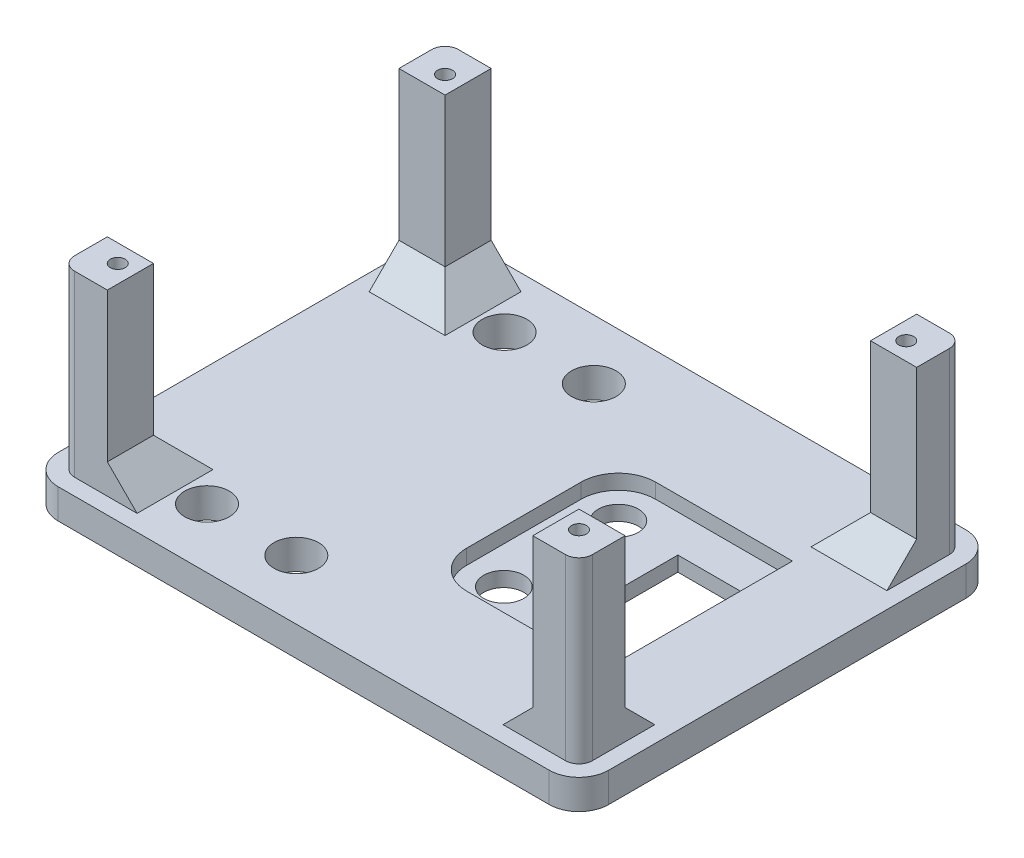
from build123d import *

# Parameters (mm, degrees)
SKETCH1_W           = 93.98
SKETCH1_H           = 71.12
BOSS_EXTRUDE1_DEPTH = 5.08
FILLET4_R           = 5.08
CUT_EXTRUDE5_REACH  = 119.967
SKETCH7_R           = 3.429
SKETCH7_W           = 13.208
SKETCH7_H           = 19.558
CUT_EXTRUDE7_DEPTH  = 2.54
CUT_EXTRUDE8_REACH  = 119.967
SKETCH8_R           = 3.81
SKETCH2_W           = 7.874
SKETCH2_H           = 7.874
BOSS_EXTRUDE3_DEPTH = 30.48
SKETCH10_R          = 1.27
CUT_EXTRUDE9_DEPTH  = 12.7
FILLET5_R           = 2.286
CHAMFER4_SIZE       = 5.08


with BuildPart() as part:
    # Sketch1 → Boss-Extrude1 (new body)
    with BuildSketch(Plane(origin=(0, 0, 0), x_dir=(1, 0, 0), z_dir=(0, 1, 0))):
        with Locations((46.99, 35.56)):
            Rectangle(SKETCH1_W, SKETCH1_H)
    extrude(amount=BOSS_EXTRUDE1_DEPTH)

    # Fillet4
    fillet4_edges = [part.edges().sort_by_distance(p)[0] for p in [
        (0, 2.54, -71.12),
        (93.98, 2.54, -71.12),
        (93.98, 2.54, 0),
        (0, 2.54, 0),
    ]]
    fillet(fillet4_edges, radius=FILLET4_R)

    # Sketch7 → Cut-Extrude5 (cut, up to next)
    with BuildSketch(Plane(origin=(0, 5.08, 0), x_dir=(1, 0, 0), z_dir=(0, 1, 0)), mode=Mode.PRIVATE) as cut_extrude5_sk1:
        with Locations((55.372, 45.339)):
            Circle(SKETCH7_R)
    cut_extrude5_tool1 = extrude(cut_extrude5_sk1.sketch, amount=-CUT_EXTRUDE5_REACH, mode=Mode.PRIVATE) & part.part
    # Sketch7 → Cut-Extrude5 (cut, up to next)
    with BuildSketch(Plane(origin=(0, 5.08, 0), x_dir=(1, 0, 0), z_dir=(0, 1, 0)), mode=Mode.PRIVATE) as cut_extrude5_sk2:
        with Locations((55.372, 25.781)):
            Circle(SKETCH7_R)
    cut_extrude5_tool2 = extrude(cut_extrude5_sk2.sketch, amount=-CUT_EXTRUDE5_REACH, mode=Mode.PRIVATE) & part.part
    # Sketch7 → Cut-Extrude5 (cut, up to next)
    with BuildSketch(Plane(origin=(0, 5.08, 0), x_dir=(1, 0, 0), z_dir=(0, 1, 0)), mode=Mode.PRIVATE) as cut_extrude5_sk3:
        with Locations((72.136, 35.56)):
            Rectangle(SKETCH7_W, SKETCH7_H)
    cut_extrude5_tool3 = extrude(cut_extrude5_sk3.sketch, amount=-CUT_EXTRUDE5_REACH, mode=Mode.PRIVATE) & part.part
    add(cut_extrude5_tool1.solids().sort_by_distance((55.372, 5.08, -45.339))[0], mode=Mode.SUBTRACT)
    add(cut_extrude5_tool2.solids().sort_by_distance((55.372, 5.08, -25.781))[0], mode=Mode.SUBTRACT)
    add(cut_extrude5_tool3.solids().sort_by_distance((72.136, 5.08, -35.56))[0], mode=Mode.SUBTRACT)

    # Sketch9 → Cut-Extrude7 (cut)
    with BuildSketch(Plane(origin=(0, 5.08, 0), x_dir=(1, 0, 0), z_dir=(0, 1, 0))):
        with BuildLine():
            Line((49.022, 45.339), (49.022, 25.781))
            ThreePointArc((49.022, 25.781), (50.881871939, 21.290871939), (55.372, 19.431))
            Line((55.372, 19.431), (65.532, 19.431))
            Line((65.532, 19.431), (78.74, 19.431))
            Line((78.74, 19.431), (78.74, 51.689))
            Line((78.74, 51.689), (65.532, 51.689))
            Line((65.532, 51.689), (55.372, 51.689))
            ThreePointArc((55.372, 51.689), (50.881871939, 49.829128061), (49.022, 45.339))
        make_face()
    extrude(amount=-CUT_EXTRUDE7_DEPTH, mode=Mode.SUBTRACT)

    # Sketch8 → Cut-Extrude8 (cut, up to next)
    with BuildSketch(Plane(origin=(0, 5.08, 0), x_dir=(1, 0, 0), z_dir=(0, 1, 0)), mode=Mode.PRIVATE) as cut_extrude8_sk1:
        with Locations((20.32, 10.16)):
            Circle(SKETCH8_R)
    cut_extrude8_tool1 = extrude(cut_extrude8_sk1.sketch, amount=-CUT_EXTRUDE8_REACH, mode=Mode.PRIVATE) & part.part
    # Sketch8 → Cut-Extrude8 (cut, up to next)
    with BuildSketch(Plane(origin=(0, 5.08, 0), x_dir=(1, 0, 0), z_dir=(0, 1, 0)), mode=Mode.PRIVATE) as cut_extrude8_sk2:
        with Locations((35.56, 10.16)):
            Circle(SKETCH8_R)
    cut_extrude8_tool2 = extrude(cut_extrude8_sk2.sketch, amount=-CUT_EXTRUDE8_REACH, mode=Mode.PRIVATE) & part.part
    # Sketch8 → Cut-Extrude8 (cut, up to next)
    with BuildSketch(Plane(origin=(0, 5.08, 0), x_dir=(1, 0, 0), z_dir=(0, 1, 0)), mode=Mode.PRIVATE) as cut_extrude8_sk3:
        with Locations((35.56, 60.96)):
            Circle(SKETCH8_R)
    cut_extrude8_tool3 = extrude(cut_extrude8_sk3.sketch, amount=-CUT_EXTRUDE8_REACH, mode=Mode.PRIVATE) & part.part
    # Sketch8 → Cut-Extrude8 (cut, up to next)
    with BuildSketch(Plane(origin=(0, 5.08, 0), x_dir=(1, 0, 0), z_dir=(0, 1, 0)), mode=Mode.PRIVATE) as cut_extrude8_sk4:
        with Locations((20.32, 60.96)):
            Circle(SKETCH8_R)
    cut_extrude8_tool4 = extrude(cut_extrude8_sk4.sketch, amount=-CUT_EXTRUDE8_REACH, mode=Mode.PRIVATE) & part.part
    add(cut_extrude8_tool1.solids().sort_by_distance((20.32, 5.08, -10.16))[0], mode=Mode.SUBTRACT)
    add(cut_extrude8_tool2.solids().sort_by_distance((35.56, 5.08, -10.16))[0], mode=Mode.SUBTRACT)
    add(cut_extrude8_tool3.solids().sort_by_distance((35.56, 5.08, -60.96))[0], mode=Mode.SUBTRACT)
    add(cut_extrude8_tool4.solids().sort_by_distance((20.32, 5.08, -60.96))[0], mode=Mode.SUBTRACT)

    # Sketch2 → Boss-Extrude3 (add)
    with BuildSketch(Plane(origin=(0, 5.08, 0), x_dir=(1, 0, 0), z_dir=(0, 1, 0))):
        with Locations((6.731, 64.389)):
            Rectangle(SKETCH2_W, SKETCH2_H)
        with Locations((87.249, 64.389)):
            Rectangle(SKETCH2_W, SKETCH2_H)
        with Locations((87.249, 6.731)):
            Rectangle(SKETCH2_W, SKETCH2_H)
        with Locations((6.731, 6.731)):
            Rectangle(SKETCH2_W, SKETCH2_H)
    extrude(amount=BOSS_EXTRUDE3_DEPTH)

    # Sketch10 → Cut-Extrude9 (cut)
    with BuildSketch(Plane(origin=(0, 35.56, 0), x_dir=(1, 0, 0), z_dir=(0, 1, 0))):
        with Locations((7.62, 63.5)):
            Circle(SKETCH10_R)
        with Locations((86.36, 63.5)):
            Circle(SKETCH10_R)
        with Locations((86.36, 7.62)):
            Circle(SKETCH10_R)
        with Locations((7.62, 7.62)):
            Circle(SKETCH10_R)
    extrude(amount=-CUT_EXTRUDE9_DEPTH, mode=Mode.SUBTRACT)

    # Fillet5
    fillet5_edges = [part.edges().sort_by_distance(p)[0] for p in [
        (91.186, 20.32, -68.326),
        (91.186, 20.32, -2.794),
        (2.794, 20.32, -2.794),
        (2.794, 20.32, -68.326),
    ]]
    fillet(fillet5_edges, radius=FILLET5_R)

    # Chamfer4
    chamfer4_edges = [part.edges().sort_by_distance(p)[0] for p in [
        (87.249, 5.08, -10.668),
        (83.312, 5.08, -6.731),
        (87.249, 5.08, -60.452),
        (83.312, 5.08, -64.389),
        (10.668, 5.08, -6.731),
        (6.731, 5.08, -10.668),
        (10.668, 5.08, -64.389),
        (6.731, 5.08, -60.452),
    ]]
    chamfer(chamfer4_edges, length=CHAMFER4_SIZE)


solid = part.part
